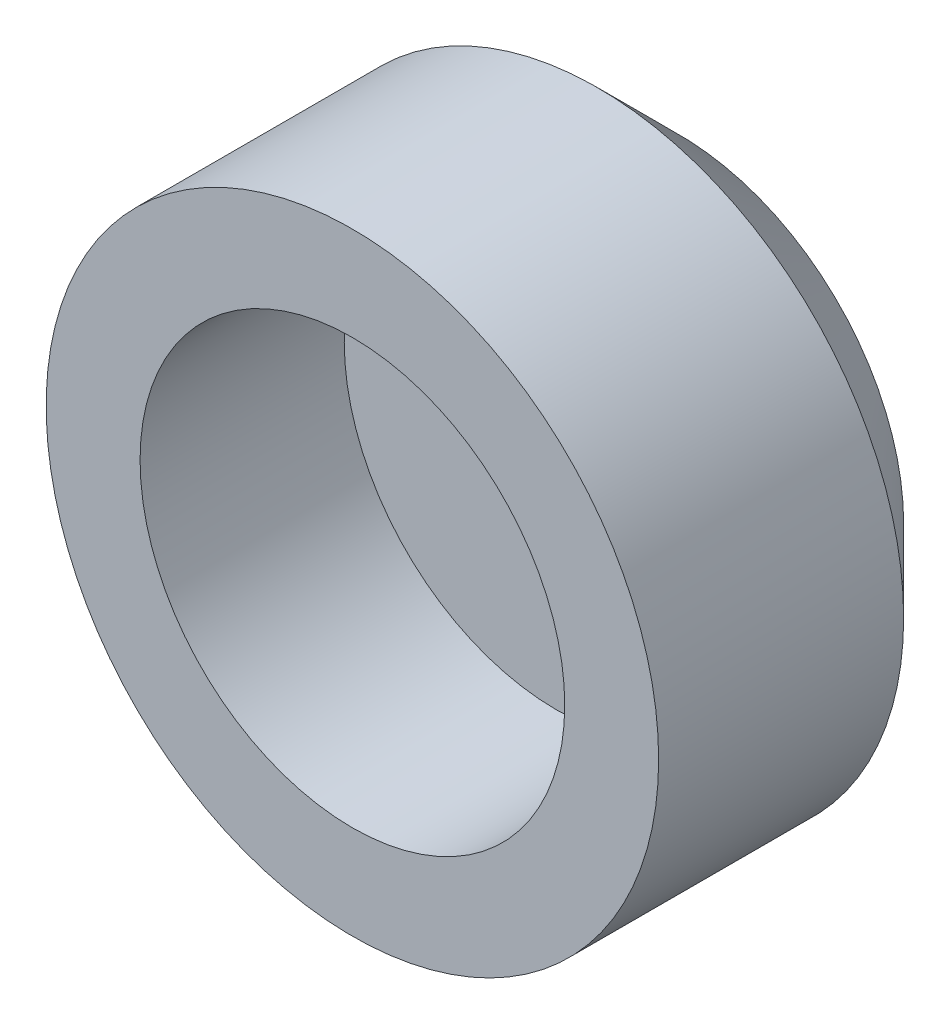
from build123d import *

# Parameters (mm, degrees)
SKETCH1_R           = 2.6
BOSS_EXTRUDE1_DEPTH = 1.5
SKETCH1_3_R         = 3.75
SKETCH1_3_R_2       = 2.6
BOSS_EXTRUDE2_DEPTH = 4
CHAMFER1_SIZE       = 1


with BuildPart() as part:
    # Sketch1 → Boss-Extrude1 (new body)
    with BuildSketch(Plane.XY):
        Circle(SKETCH1_R)
    extrude(amount=BOSS_EXTRUDE1_DEPTH)

    # Sketch1<3> → Boss-Extrude2 (add)
    with BuildSketch(Plane.XY):
        Circle(SKETCH1_3_R)
        Circle(SKETCH1_3_R_2, mode=Mode.SUBTRACT)
    extrude(amount=BOSS_EXTRUDE2_DEPTH)

    # Chamfer1
    chamfer1_edges = [part.edges().sort_by_distance(p)[0] for p in [
        (-3.75, 0, 0),
    ]]
    chamfer(chamfer1_edges, length=CHAMFER1_SIZE)


solid = part.part
